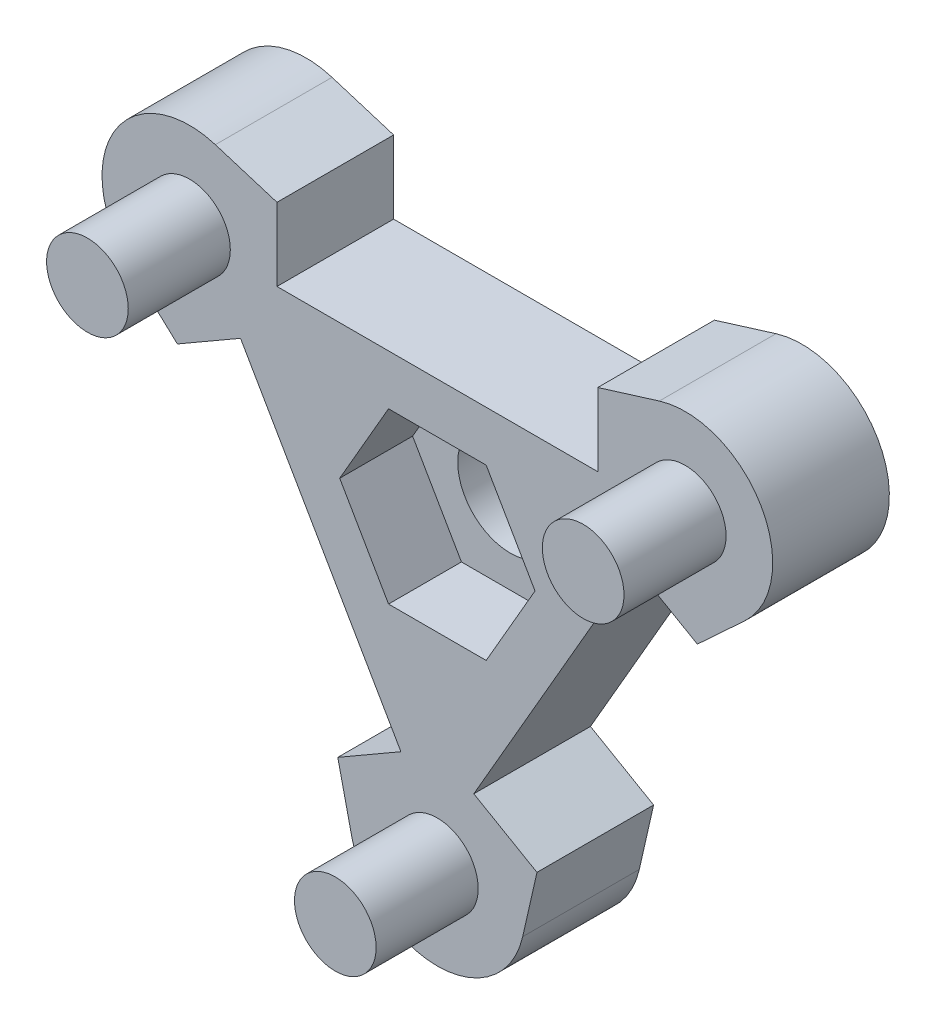
from build123d import *

# Parameters (mm, degrees)
EXTRUDE_1_DEPTH     = 4
SKETCH_2_R          = 1.4
EXTRUDE_2_DEPTH     = 3.5
CUT_EXTRUDE_1_DEPTH = 2.5
SKETCH_6_R          = 1.8
CUT_EXTRUDE_2_DEPTH = 19.780922789


with BuildPart() as part:
    # ｽｹｯﾁ1 → ﾎﾞｽ - 押し出し1 (new body)
    with BuildSketch(Plane.XY):
        with BuildLine():
            Line((-7, 2.309401077), (-6.75, 2.453738644))
            Line((-6.75, 2.453738644), (-1.25, -7.072540798))
            Line((-1.25, -7.072540798), (-1.5, -7.216878365))
            Line((-1.5, -7.216878365), (-3.415063509, -8.322540798))
            Line((-3.415063509, -8.322540798), (-2.925581753, -10.479011356))
            ThreePointArc((-2.925581753, -10.479011356), (0, -12.814954576), (2.925581753, -10.479011356))
            Line((2.925581753, -10.479011356), (3.415063509, -8.322540798))
            Line((3.415063509, -8.322540798), (1.5, -7.216878365))
            Line((1.5, -7.216878365), (1.25, -7.072540798))
            Line((1.25, -7.072540798), (6.75, 2.453738644))
            Line((6.75, 2.453738644), (7, 2.309401077))
            Line((7, 2.309401077), (8.915063509, 1.203738644))
            Line((8.915063509, 1.203738644), (10.537880917, 2.705877559))
            ThreePointArc((10.537880917, 2.705877559), (11.098076211, 6.407477288), (7.612299165, 7.773133797))
            Line((7.612299165, 7.773133797), (5.5, 7.118802154))
            Line((5.5, 7.118802154), (5.5, 4.907477288))
            Line((5.5, 4.907477288), (5.5, 4.618802154))
            Line((5.5, 4.618802154), (-5.5, 4.618802154))
            Line((-5.5, 4.618802154), (-5.5, 4.907477288))
            Line((-5.5, 4.907477288), (-5.5, 7.118802154))
            Line((-5.5, 7.118802154), (-7.612299165, 7.773133797))
            ThreePointArc((-7.612299165, 7.773133797), (-11.098076211, 6.407477288), (-10.537880917, 2.705877559))
            Line((-10.537880917, 2.705877559), (-8.915063509, 1.203738644))
            Line((-8.915063509, 1.203738644), (-7, 2.309401077))
        make_face()
    extrude(amount=EXTRUDE_1_DEPTH)

    # ｽｹｯﾁ2 → ﾎﾞｽ - 押し出し2 (add)
    with BuildSketch(Plane.XY.offset(4)):
        with Locations((-8.5, 4.907477288)):
            Circle(SKETCH_2_R)
        with Locations((0, -9.814954576)):
            Circle(SKETCH_2_R)
        with Locations((8.5, 4.907477288)):
            Circle(SKETCH_2_R)
    extrude(amount=EXTRUDE_2_DEPTH)

    # ｽｹｯﾁ4 → ｶｯﾄ - 押し出し1 (cut)
    with BuildSketch(Plane.XY.offset(4)):
        Polygon((-1.674315781, -2.9), (1.674315781, -2.9), (3.348631561, 0), (1.674315781, 2.9), (-1.674315781, 2.9), (-3.348631561, 0), align=None)
    extrude(amount=-CUT_EXTRUDE_1_DEPTH, mode=Mode.SUBTRACT)

    # ｽｹｯﾁ6 → ｶｯﾄ - 押し出し2 (cut, through all)
    with BuildSketch(Plane(origin=(0, 0, 0), x_dir=(-1, 0, 0), z_dir=(0, 0, -1))):
        Circle(SKETCH_6_R)
    extrude(amount=-CUT_EXTRUDE_2_DEPTH, mode=Mode.SUBTRACT)


solid = part.part
